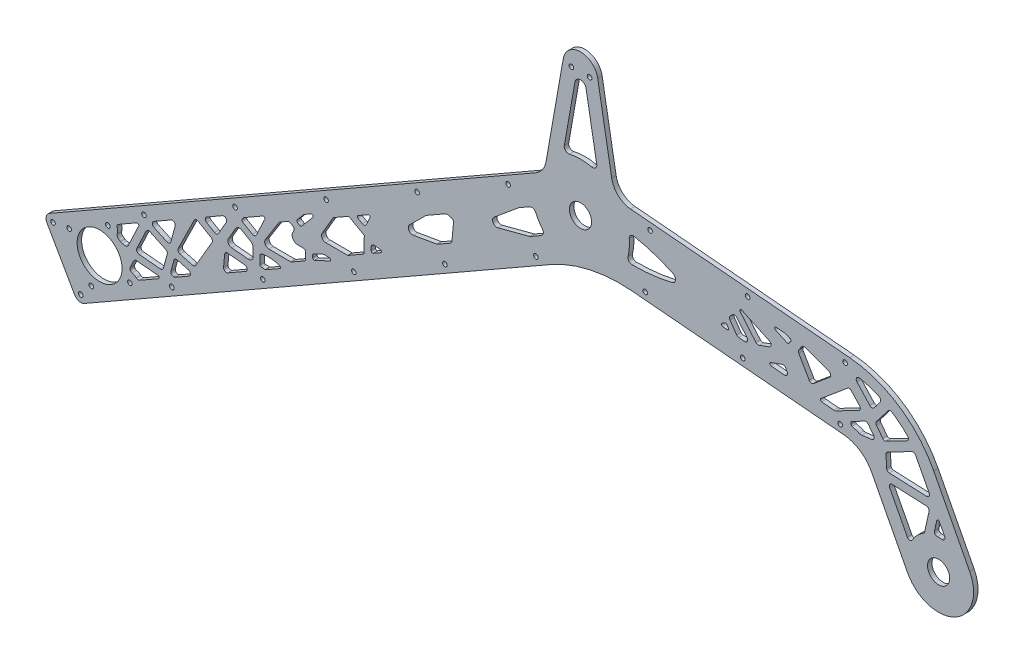
from build123d import *

# Parameters (mm, degrees)
SKETCH2_R              = 7.9375
SKETCH2_R_2            = 16.05
SKETCH2_R_3            = 1.65
BASE_DEPTH             = 3.175
SKETCH3_R              = 1.65
STRUT_HOLES_DEPTH      = 448.434897902
LIGHTENING_HOLES_DEPTH = 448.434897902


with BuildPart() as part:
    # Sketch2 → Base (new body)
    with BuildSketch(Plane.XY):
        with BuildLine():
            Line((-379.716809958, -188.506893436), (-32.006532147, 10.487277971))
            ThreePointArc((-32.006532147, 10.487277971), (-27.186230121, 14.879084252), (-24.685038782, 20.901319377))
            Line((-24.685038782, 20.901319377), (-12.310096913, 91.083102221))
            ThreePointArc((-12.310096913, 91.083102221), (0, 101.4125), (12.310096913, 91.083102221))
            Line((12.310096913, 91.083102221), (22.322003955, 34.302755831))
            ThreePointArc((22.322003955, 34.302755831), (26.960267136, 25.848318444), (35.786784109, 21.964558025))
            Line((35.786784109, 21.964558025), (192.586144941, 8.246391504))
            ThreePointArc((192.586144941, 8.246391504), (227.717231711, -4.10798993), (252.575276723, -31.83706486))
            Line((252.575276723, -31.83706486), (278.255270829, -81.167874559))
            ThreePointArc((278.255270829, -81.167874559), (267.623715331, -114.886860719), (233.904729171, -104.255305221))
            Line((233.904729171, -104.255305221), (208.224735064, -54.924495522))
            ThreePointArc((208.224735064, -54.924495522), (199.93872006, -45.681470545), (188.228357804, -41.563343401))
            Line((188.228357804, -41.563343401), (36.823729736, -28.317154839))
            ThreePointArc((36.823729736, -28.317154839), (6.649577682, -30.266109959), (-21.562664076, -41.144864173))
            Line((-21.562664076, -41.144864173), (-354.881400189, -231.902773674))
            ThreePointArc((-354.881400189, -231.902773674), (-358.677364619, -232.387866435), (-361.70452919, -230.046726627))
            Line((-361.70452919, -230.046726627), (-381.572857005, -195.330022437))
            ThreePointArc((-381.572857005, -195.330022437), (-382.057949767, -191.534058007), (-379.716809958, -188.506893436))
        make_face()
        Circle(SKETCH2_R, mode=Mode.SUBTRACT)
        with Locations((-343.92, -196.825)):
            Circle(SKETCH2_R_2, mode=Mode.SUBTRACT)
        with Locations((-6.5, 88.9125)):
            Circle(SKETCH2_R_3, mode=Mode.SUBTRACT)
        with Locations((6.5, 88.9125)):
            Circle(SKETCH2_R_3, mode=Mode.SUBTRACT)
        with Locations((256.08, -92.71158989)):
            Circle(SKETCH2_R, mode=Mode.SUBTRACT)
        with Locations((-365.631063534, -190.919094461)):
            Circle(SKETCH2_R_3, mode=Mode.SUBTRACT)
        with Locations((-338.014094461, -175.113936466)):
            Circle(SKETCH2_R_3, mode=Mode.SUBTRACT)
        with Locations((-322.208936466, -202.730905539)):
            Circle(SKETCH2_R_3, mode=Mode.SUBTRACT)
        with Locations((-349.825905539, -218.536063534)):
            Circle(SKETCH2_R_3, mode=Mode.SUBTRACT)
    extrude(amount=BASE_DEPTH)

    # Sketch3 → Strut Holes (cut, through all)
    with BuildSketch(Plane.XY.offset(3.175)):
        with Locations((-357.364941166, -227.56318565)):
            Circle(SKETCH3_R)
        with Locations((-292.27112081, -190.310070996)):
            Circle(SKETCH3_R)
        with Locations((-227.177300453, -153.056956343)):
            Circle(SKETCH3_R)
        with Locations((-162.083480097, -115.803841689)):
            Circle(SKETCH3_R)
        with Locations((-96.98965974, -78.550727035)):
            Circle(SKETCH3_R)
        with Locations((-31.895839384, -41.297612382)):
            Circle(SKETCH3_R)
        with Locations((-312.139448625, -155.593366806)):
            Circle(SKETCH3_R)
        with Locations((-377.233268981, -192.84648146)):
            Circle(SKETCH3_R)
        with Locations((-247.045628268, -118.340252152)):
            Circle(SKETCH3_R)
        with Locations((-181.951807912, -81.087137499)):
            Circle(SKETCH3_R)
        with Locations((-116.857987555, -43.834022845)):
            Circle(SKETCH3_R)
        with Locations((-51.764167199, -6.580908192)):
            Circle(SKETCH3_R)
        with Locations((46.269308527, -24.124436716)):
            Circle(SKETCH3_R)
        with Locations((116.002937393, -30.225338708)):
            Circle(SKETCH3_R)
        with Locations((185.73656626, -36.326240701)):
            Circle(SKETCH3_R)
        with Locations((189.222795969, 3.521547223)):
            Circle(SKETCH3_R)
        with Locations((119.489167103, 9.622449215)):
            Circle(SKETCH3_R)
        with Locations((49.755538237, 15.723351208)):
            Circle(SKETCH3_R)
    extrude(amount=-STRUT_HOLES_DEPTH, mode=Mode.SUBTRACT)

    # Sketch6 → Lightening Holes (cut, through all)
    with BuildSketch(Plane.XY.offset(3.175)):
        with BuildLine():
            Line((-315.269185897, -197.710920307), (-301.759255291, -189.979203363))
            ThreePointArc((-301.759255291, -189.979203363), (-301.27885272, -188.89855459), (-302.165025934, -188.115429161))
            Line((-302.165025934, -188.115429161), (-317.529091672, -186.71244549))
            ThreePointArc((-317.529091672, -186.71244549), (-318.704383169, -186.968323474), (-319.520360019, -187.852045956))
            Line((-319.520360019, -187.852045956), (-321.920665487, -192.94890269))
            ThreePointArc((-321.920665487, -192.94890269), (-322.086706026, -193.488507205), (-322.095332893, -194.053014132))
            ThreePointArc((-322.095332893, -194.053014132), (-322.08483495, -194.136958475), (-322.074659882, -194.220942566))
            ThreePointArc((-322.074659882, -194.220942566), (-321.584640098, -195.311697425), (-320.559879114, -195.927920176))
            ThreePointArc((-320.559879114, -195.927920176), (-318.977814459, -196.521247692), (-317.584009883, -197.476378529))
            ThreePointArc((-317.584009883, -197.476378529), (-316.464213346, -197.964897395), (-315.269185897, -197.710920307))
        make_face()
        with BuildLine():
            Line((-289.844978396, -183.160677107), (-279.93882887, -177.491399715))
            ThreePointArc((-279.93882887, -177.491399715), (-278.948378644, -175.502042811), (-280.407275879, -173.825692191))
            Line((-280.407275879, -173.825692191), (-288.292322007, -171.680779414))
            ThreePointArc((-288.292322007, -171.680779414), (-289.810707779, -171.874816518), (-290.747163702, -173.085682346))
            Line((-290.747163702, -173.085682346), (-292.868560549, -180.884280112))
            ThreePointArc((-292.868560549, -180.884280112), (-292.613471256, -182.502456625), (-291.234784363, -183.387209827))
            ThreePointArc((-291.234784363, -183.387209827), (-291.195764259, -183.393163574), (-291.156778347, -183.399337252))
            ThreePointArc((-291.156778347, -183.399337252), (-290.480404568, -183.392541824), (-289.844978396, -183.160677107))
        make_face()
        with BuildLine():
            Line((-225.068253149, -146.0890356), (-215.065938543, -140.36472305))
            ThreePointArc((-215.065938543, -140.36472305), (-214.567033215, -139.40324417), (-215.236329185, -138.55154524))
            ThreePointArc((-215.236329185, -138.55154524), (-221.331874052, -137.268264968), (-227.555460503, -137.531793255))
            ThreePointArc((-227.555460503, -137.531793255), (-228.747493021, -138.209832448), (-229.222550686, -139.49630005))
            Line((-229.222550686, -139.49630005), (-229.243920799, -145.124584195))
            ThreePointArc((-229.243920799, -145.124584195), (-228.903638362, -145.87990104), (-228.110599563, -146.11945299))
            ThreePointArc((-228.110599563, -146.11945299), (-226.935128796, -146.061146676), (-225.766503733, -146.200597789))
            ThreePointArc((-225.766503733, -146.200597789), (-225.407188584, -146.208593442), (-225.068253149, -146.0890356))
        make_face()
        with BuildLine():
            Line((-202.41887229, -105.511400104), (-200.686234771, -106.520529682))
            ThreePointArc((-200.686234771, -106.520529682), (-200.013042452, -106.64186894), (-199.419351845, -106.302100524))
            Line((-199.419351845, -106.302100524), (-191.360868047, -96.772094027))
            ThreePointArc((-191.360868047, -96.772094027), (-191.355986863, -95.486528074), (-192.621174572, -95.258484862))
            Line((-192.621174572, -95.258484862), (-197.478989202, -98.038606299))
            ThreePointArc((-197.478989202, -98.038606299), (-197.765321596, -98.237482482), (-198.01276947, -98.483058387))
            Line((-198.01276947, -98.483058387), (-202.679186023, -104.001587826))
            ThreePointArc((-202.679186023, -104.001587826), (-202.901047671, -104.817187109), (-202.41887229, -105.511400104))
        make_face()
        with BuildLine():
            Line((-330.425499061, -170.667183769), (-317.378257487, -163.200263197))
            ThreePointArc((-317.378257487, -163.200263197), (-316.203164595, -163.333473919), (-315.976852671, -164.494237166))
            Line((-315.976852671, -164.494237166), (-323.402158767, -180.26128093))
            ThreePointArc((-323.402158767, -180.26128093), (-324.218135617, -181.145003412), (-325.393427114, -181.400881396))
            Line((-325.393427114, -181.400881396), (-327.826064744, -181.178742873))
            ThreePointArc((-327.826064744, -181.178742873), (-328.456346912, -181.014705953), (-329.000507167, -180.656860539))
            ThreePointArc((-329.000507167, -180.656860539), (-329.788551481, -179.963737807), (-330.608754561, -179.308986045))
            ThreePointArc((-330.608754561, -179.308986045), (-331.300981929, -178.333954341), (-331.313186478, -177.138246768))
            ThreePointArc((-331.313186478, -177.138246768), (-331.014233087, -175.069882607), (-331.339196402, -173.005445087))
            ThreePointArc((-331.339196402, -173.005445087), (-331.294912573, -171.675100882), (-330.425499061, -170.667183769))
        make_face()
        with BuildLine():
            Line((-295.53330948, -171.631597975), (-298.296173769, -181.788333758))
            ThreePointArc((-298.296173769, -181.788333758), (-299.085121934, -182.906012266), (-300.407921189, -183.255077571))
            Line((-300.407921189, -183.255077571), (-315.662540801, -181.862088072))
            ThreePointArc((-315.662540801, -181.862088072), (-317.216500905, -180.86379127), (-317.290058936, -179.018262152))
            Line((-317.290058936, -179.018262152), (-310.641451377, -164.900475625))
            ThreePointArc((-310.641451377, -164.900475625), (-309.508957679, -163.870619434), (-307.979945409, -163.943195111))
            Line((-307.979945409, -163.943195111), (-296.611069066, -169.297235353))
            ThreePointArc((-296.611069066, -169.297235353), (-295.647370018, -170.26828046), (-295.53330948, -171.631597975))
        make_face()
        with BuildLine():
            Line((-292.778723285, -149.121979529), (-305.215642876, -156.239613568))
            ThreePointArc((-305.215642876, -156.239613568), (-306.220639762, -158.055100377), (-305.074339213, -159.784842018))
            Line((-305.074339213, -159.784842018), (-295.766029178, -164.168482495))
            ThreePointArc((-295.766029178, -164.168482495), (-294.075568316, -164.17490103), (-292.984044137, -162.884058635))
            Line((-292.984044137, -162.884058635), (-289.85543458, -151.38278412))
            ThreePointArc((-289.85543458, -151.38278412), (-290.561768266, -149.275742292), (-292.778723285, -149.121979529))
        make_face()
        with BuildLine():
            Line((-286.412158457, -167.010536912), (-277.477694151, -169.440915421))
            ThreePointArc((-277.477694151, -169.440915421), (-276.194379154, -169.361694864), (-275.224483334, -168.5176123))
            Line((-275.224483334, -168.5176123), (-263.487039881, -148.364863469))
            ThreePointArc((-263.487039881, -148.364863469), (-263.281478176, -146.847994939), (-264.208712124, -145.63005284))
            Line((-264.208712124, -145.63005284), (-273.491108909, -140.223762697))
            ThreePointArc((-273.491108909, -140.223762697), (-275.075155334, -140.037188202), (-276.291924346, -141.06844292))
            Line((-276.291924346, -141.06844292), (-287.68143532, -164.197103385))
            ThreePointArc((-287.68143532, -164.197103385), (-287.710247586, -165.903135064), (-286.412158457, -167.010536912))
        make_face()
        with BuildLine():
            Line((-267.326941544, -134.555955625), (-255.981699002, -128.063087041))
            ThreePointArc((-255.981699002, -128.063087041), (-253.568709634, -128.390088491), (-253.260041176, -130.805491443))
            Line((-253.260041176, -130.805491443), (-258.957478514, -140.587777008))
            ThreePointArc((-258.957478514, -140.587777008), (-260.175420613, -141.515010956), (-261.692289142, -141.309449251))
            Line((-261.692289142, -141.309449251), (-267.340094346, -138.02003227))
            ThreePointArc((-267.340094346, -138.02003227), (-268.333510737, -136.284197061), (-267.326941544, -134.555955625))
        make_face()
        with BuildLine():
            Line((-255.261313261, -159.742391016), (-254.488576255, -151.280152708))
            ThreePointArc((-254.488576255, -151.280152708), (-253.776611846, -149.925068788), (-252.314987955, -149.470314621))
            Line((-252.314987955, -149.470314621), (-240.229659184, -150.573897437))
            ThreePointArc((-240.229659184, -150.573897437), (-238.457312757, -152.140148294), (-239.418117899, -154.30144584))
            Line((-239.418117899, -154.30144584), (-252.276183677, -161.660101332))
            ThreePointArc((-252.276183677, -161.660101332), (-254.350596062, -161.606956723), (-255.261313261, -159.742391016))
        make_face()
        with BuildLine():
            Line((-246.540160509, -131.189393308), (-251.794794147, -140.211401578))
            ThreePointArc((-251.794794147, -140.211401578), (-251.868704934, -143.096387582), (-249.475244653, -144.708825158))
            Line((-249.475244653, -144.708825158), (-237.508018237, -145.801623349))
            ThreePointArc((-237.508018237, -145.801623349), (-235.21684764, -145.033565045), (-234.235227202, -142.825444219))
            Line((-234.235227202, -142.825444219), (-234.211718457, -136.633904573))
            ThreePointArc((-234.211718457, -136.633904573), (-234.607944018, -135.132389326), (-235.701843043, -134.030151758))
            Line((-235.701843043, -134.030151758), (-242.437944567, -130.106884943))
            ThreePointArc((-242.437944567, -130.106884943), (-244.713247361, -129.798542386), (-246.540160509, -131.189393308))
        make_face()
        with BuildLine():
            Line((-241.753564235, -124.719255848), (-234.63976684, -128.862501783))
            ThreePointArc((-234.63976684, -128.862501783), (-233.039032694, -129.043963991), (-231.823804406, -127.986373074))
            Line((-231.823804406, -127.986373074), (-225.796901327, -115.1887263))
            ThreePointArc((-225.796901327, -115.1887263), (-226.023213251, -114.027963054), (-227.198306143, -113.894752332))
            Line((-227.198306143, -113.894752332), (-240.486863137, -121.499777426))
            ThreePointArc((-240.486863137, -121.499777426), (-240.868014227, -121.782834524), (-241.171709307, -122.147754751))
            ThreePointArc((-241.171709307, -122.147754751), (-241.549582312, -122.675396768), (-241.974698217, -123.165774758))
            ThreePointArc((-241.974698217, -123.165774758), (-242.240299662, -123.996061899), (-241.753564235, -124.719255848))
        make_face()
        with BuildLine():
            Line((-215.668807888, -112.174898455), (-225.379976009, -127.585503674))
            ThreePointArc((-225.379976009, -127.585503674), (-225.4712487, -130.629365716), (-222.853276851, -132.184888211))
            Line((-222.853276851, -132.184888211), (-207.454371398, -132.243356535))
            ThreePointArc((-207.454371398, -132.243356535), (-206.936478287, -132.177174092), (-206.453361233, -131.979206161))
            Line((-206.453361233, -131.979206161), (-197.505650544, -126.858442157))
            ThreePointArc((-197.505650544, -126.858442157), (-196.770825499, -126.12917614), (-196.499081351, -125.130200721))
            Line((-196.499081351, -125.130200721), (-196.484480993, -121.28487852))
            ThreePointArc((-196.484480993, -121.28487852), (-197.064893599, -119.868450986), (-198.476872802, -119.277299162))
            Line((-198.476872802, -119.277299162), (-202.260748213, -119.262932112))
            ThreePointArc((-202.260748213, -119.262932112), (-205.751377346, -117.188902119), (-205.629680425, -113.130419396))
            Line((-205.629680425, -113.130419396), (-205.026921593, -112.173904352))
            ThreePointArc((-205.026921593, -112.173904352), (-204.776566908, -110.63116148), (-205.712412279, -109.379392142))
            Line((-205.712412279, -109.379392142), (-207.46181523, -108.360497976))
            ThreePointArc((-207.46181523, -108.360497976), (-208.460790649, -108.088753828), (-209.461800813, -108.352904202))
            Line((-209.461800813, -108.352904202), (-214.9701644, -111.50533402))
            ThreePointArc((-214.9701644, -111.50533402), (-215.360592232, -111.79722492), (-215.668807888, -112.174898455))
        make_face()
        with BuildLine():
            Line((-191.479772218, -120.054212502), (-191.486581073, -121.847472571))
            ThreePointArc((-191.486581073, -121.847472571), (-191.027086278, -122.692614758), (-190.067414214, -122.759175345))
            Line((-190.067414214, -122.759175345), (-179.245533818, -117.762785652))
            ThreePointArc((-179.245533818, -117.762785652), (-178.687597118, -116.642148596), (-179.660910998, -115.854886972))
            Line((-179.660910998, -115.854886972), (-183.284876561, -115.841127086))
            ThreePointArc((-183.284876561, -115.841127086), (-183.717932672, -115.886891136), (-184.13081847, -116.025300894))
            Line((-184.13081847, -116.025300894), (-190.898953493, -119.150103501))
            ThreePointArc((-190.898953493, -119.150103501), (-191.321124727, -119.517511391), (-191.479772218, -120.054212502))
        make_face()
        with BuildLine():
            Line((-166.401123038, -107.905175585), (-182.204856698, -107.845170163))
            ThreePointArc((-182.204856698, -107.845170163), (-184.797218852, -106.335316373), (-184.785828191, -103.335337998))
            Line((-184.785828191, -103.335337998), (-176.831995141, -89.678905885))
            Line((-176.831995141, -89.678905885), (-165.638950905, -83.273140207))
            Line((-165.638950905, -83.273140207), (-154.64049223, -89.678905885))
            Line((-154.64049223, -89.678905885), (-154.684235374, -101.199614947))
            Line((-154.684235374, -101.199614947), (-166.401123038, -107.905175585))
        make_face()
        with BuildLine():
            Line((-149.666734346, -96.599830521), (-149.657550536, -94.181074309))
            ThreePointArc((-149.657550536, -94.181074309), (-149.003136911, -92.708993759), (-147.475689846, -92.196954889))
            Line((-147.475689846, -92.196954889), (-143.284670701, -92.579661624))
            ThreePointArc((-143.284670701, -92.579661624), (-142.398497488, -93.362787052), (-142.878900059, -94.443435825))
            Line((-142.878900059, -94.443435825), (-148.170033359, -97.471545013))
            ThreePointArc((-148.170033359, -97.471545013), (-149.170026151, -97.467748126), (-149.666734346, -96.599830521))
        make_face()
        with BuildLine():
            Line((-159.124748889, -79.545070273), (-152.013980011, -75.475585845))
            ThreePointArc((-152.013980011, -75.475585845), (-150.838887119, -75.608796567), (-150.612575195, -76.769559813))
            Line((-150.612575195, -76.769559813), (-153.182146906, -82.225839878))
            ThreePointArc((-153.182146906, -82.225839878), (-154.397375194, -83.283430795), (-155.99810934, -83.101968586))
            Line((-155.99810934, -83.101968586), (-159.13132529, -81.277108596))
            ThreePointArc((-159.13132529, -81.277108596), (-159.628033486, -80.409190991), (-159.124748889, -79.545070273))
        make_face()
        with BuildLine():
            Line((-90.819864813, -49.698540482), (-91.896421351, -61.487904644))
            ThreePointArc((-91.896421351, -61.487904644), (-92.359955239, -62.836585977), (-93.393866555, -63.818844799))
            Line((-93.393866555, -63.818844799), (-101.994338017, -68.740884214))
            ThreePointArc((-101.994338017, -68.740884214), (-102.469113289, -68.960084777), (-102.974739436, -69.09351133))
            Line((-102.974739436, -69.09351133), (-119.629879497, -71.965101226))
            ThreePointArc((-119.629879497, -71.965101226), (-122.805875604, -70.383853511), (-122.252853304, -66.87936183))
            Line((-122.252853304, -66.87936183), (-110.681116507, -55.395166432))
            ThreePointArc((-110.681116507, -55.395166432), (-110.385100172, -55.137548838), (-110.057990454, -54.920773084))
            Line((-110.057990454, -54.920773084), (-96.724691463, -47.290142199))
            ThreePointArc((-96.724691463, -47.290142199), (-95.614849419, -46.918095089), (-94.447112805, -46.999086542))
            Line((-94.447112805, -46.999086542), (-92.286608626, -47.586793062))
            ThreePointArc((-92.286608626, -47.586793062), (-91.168930118, -48.375741228), (-90.819864813, -49.698540482))
        make_face()
        with BuildLine():
            Line((-28.096781534, -26.449402024), (-35.825401618, -30.87248195))
            ThreePointArc((-35.825401618, -30.87248195), (-36.178007781, -31.044706772), (-36.550077199, -31.169433846))
            Line((-36.550077199, -31.169433846), (-59.133973609, -37.128958431))
            ThreePointArc((-59.133973609, -37.128958431), (-62.565695554, -35.603385935), (-61.819045791, -31.92281518))
            Line((-61.819045791, -31.92281518), (-44.317223042, -17.349924163))
            ThreePointArc((-44.317223042, -17.349924163), (-44.108986088, -17.191390869), (-43.887724451, -17.051609889))
            Line((-43.887724451, -17.051609889), (-36.274597881, -12.694626761))
            ThreePointArc((-36.274597881, -12.694626761), (-33.845543285, -12.449097133), (-32.038330666, -14.090612767))
            ThreePointArc((-32.038330666, -14.090612767), (-29.904900702, -18.185073934), (-27.251097742, -21.963097956))
            ThreePointArc((-27.251097742, -21.963097956), (-26.638826778, -24.401372335), (-28.096781534, -26.449402024))
        make_face()
        with BuildLine():
            Line((-11.599665343, 37.524455033), (-3.986146646, 80.702865203))
            ThreePointArc((-3.986146646, 80.702865203), (0, 84.047639383), (3.986146646, 80.702865203))
            Line((3.986146646, 80.702865203), (11.599665343, 37.524455033))
            ThreePointArc((11.599665343, 37.524455033), (10.707449692, 34.824680589), (7.962722972, 34.082180723))
            ThreePointArc((7.962722972, 34.082180723), (0, 35), (-7.962722972, 34.082180723))
            ThreePointArc((-7.962722972, 34.082180723), (-10.707449692, 34.824680589), (-11.599665343, 37.524455033))
        make_face()
        with BuildLine():
            Line((246.075987756, -72.913561708), (249.254007124, -58.57844272))
            ThreePointArc((249.254007124, -58.57844272), (248.888121791, -56.928040634), (247.388653885, -56.147467049))
            Line((247.388653885, -56.147467049), (222.962162816, -55.080983417))
            ThreePointArc((222.962162816, -55.080983417), (221.188141149, -56.004480644), (221.100902375, -58.002577087))
            Line((221.100902375, -58.002577087), (233.735290203, -82.273010289))
            ThreePointArc((233.735290203, -82.273010289), (235.484637714, -83.349360854), (237.260008731, -82.316498325))
            ThreePointArc((237.260008731, -82.316498325), (240.657318696, -77.731906936), (245.140979083, -74.202461834))
            ThreePointArc((245.140979083, -74.202461834), (245.742284649, -73.655075389), (246.075987756, -72.913561708))
        make_face()
        with BuildLine():
            Line((253.133679234, -68.799730633), (254.751992566, -61.499990928))
            ThreePointArc((254.751992566, -61.499990928), (255.597762381, -60.72498568), (256.615299406, -61.254681929))
            Line((256.615299406, -61.254681929), (260.345615198, -68.420551892))
            ThreePointArc((260.345615198, -68.420551892), (260.223925452, -70.470902803), (258.359543018, -71.332775993))
            ThreePointArc((258.359543018, -71.332775993), (256.767087179, -71.222571503), (255.170843908, -71.230820928))
            ThreePointArc((255.170843908, -71.230820928), (253.553325039, -70.51716267), (253.133679234, -68.799730633))
        make_face()
        with BuildLine():
            Line((249.310771487, -47.22281435), (239.59747458, -28.563744597))
            ThreePointArc((239.59747458, -28.563744597), (238.424864512, -27.579807922), (236.899955687, -27.713220157))
            Line((236.899955687, -27.713220157), (219.565597936, -36.736915644))
            ThreePointArc((219.565597936, -36.736915644), (218.757044355, -37.510937311), (218.490998719, -38.598176086))
            Line((218.490998719, -38.598176086), (218.860832904, -47.068771554))
            ThreePointArc((218.860832904, -47.068771554), (219.444715785, -48.395746342), (220.771690573, -48.979629223))
            Line((220.771690573, -48.979629223), (247.449511046, -50.144408019))
            ThreePointArc((247.449511046, -50.144408019), (249.223532712, -49.220910793), (249.310771487, -47.22281435))
        make_face()
        with BuildLine():
            Line((233.413458883, -22.763883833), (218.618137266, -30.46584077))
            ThreePointArc((218.618137266, -30.46584077), (217.261760811, -30.644411118), (216.107933359, -29.909341962))
            Line((216.107933359, -29.909341962), (211.671799483, -24.128059737))
            ThreePointArc((211.671799483, -24.128059737), (211.258506163, -22.910536879), (211.671799483, -21.693014021))
            Line((211.671799483, -21.693014021), (220.007167815, -10.830150518))
            ThreePointArc((220.007167815, -10.830150518), (221.257760997, -10.076118732), (222.687548657, -10.3731953))
            ThreePointArc((222.687548657, -10.3731953), (228.553817552, -14.676513168), (233.918900039, -19.590528361))
            ThreePointArc((233.918900039, -19.590528361), (234.465065341, -21.304449895), (233.413458883, -22.763883833))
        make_face()
        with BuildLine():
            Line((209.61657846, -31.305721344), (205.746256457, -26.261819508))
            ThreePointArc((205.746256457, -26.261819508), (204.592429004, -25.526750352), (203.23605255, -25.7053207))
            Line((203.23605255, -25.7053207), (194.010059092, -30.508068903))
            ThreePointArc((194.010059092, -30.508068903), (193.616895834, -30.876306478), (193.471807705, -31.395079736))
            Line((193.471807705, -31.395079736), (193.471807705, -32.496691451))
            ThreePointArc((193.471807705, -32.496691451), (193.684204256, -33.112873898), (194.23116932, -33.467306291))
            ThreePointArc((194.23116932, -33.467306291), (196.89746606, -34.245224393), (199.491371204, -35.238175037))
            ThreePointArc((199.491371204, -35.238175037), (200.2654041, -35.454155852), (201.069000396, -35.456918226))
            Line((201.069000396, -35.456918226), (208.290924164, -34.506133925))
            ThreePointArc((208.290924164, -34.506133925), (209.877630844, -33.288611067), (209.61657846, -31.305721344))
        make_face()
        with BuildLine():
            Line((214.303083467, -8.407780179), (209.957683706, -14.070815403))
            ThreePointArc((209.957683706, -14.070815403), (208.4582158, -14.851388988), (206.896422352, -14.20447296))
            Line((206.896422352, -14.20447296), (197.688681904, -4.155987535))
            ThreePointArc((197.688681904, -4.155987535), (197.423723958, -1.817844179), (199.566737265, -0.845933158))
            ThreePointArc((199.566737265, -0.845933158), (206.676023639, -2.722269436), (213.536897173, -5.366320289))
            ThreePointArc((213.536897173, -5.366320289), (214.655785228, -6.701693203), (214.303083467, -8.407780179))
        make_face()
        with BuildLine():
            Line((193.681402215, -11.624307007), (199.545514004, -18.023862053))
            ThreePointArc((199.545514004, -18.023862053), (200.040574836, -19.722338824), (198.994456557, -21.149064135))
            Line((198.994456557, -21.149064135), (182.807531418, -29.575444012))
            ThreePointArc((182.807531418, -29.575444012), (182.007556544, -29.856767353), (181.16081835, -29.902995606))
            Line((181.16081835, -29.902995606), (172.48260155, -29.143750017))
            ThreePointArc((172.48260155, -29.143750017), (171.616040342, -28.448261118), (171.926969683, -27.381510875))
            Line((171.926969683, -27.381510875), (190.921272322, -11.443398536))
            ThreePointArc((190.921272322, -11.443398536), (192.3376538, -10.979769576), (193.681402215, -11.624307007))
        make_face()
        with BuildLine():
            Line((178.199205815, -11.022517891), (166.591800736, -20.762287211))
            ThreePointArc((166.591800736, -20.762287211), (164.958929162, -21.199813831), (163.574174709, -20.230198325))
            Line((163.574174709, -20.230198325), (156.047951006, -7.194396481))
            ThreePointArc((156.047951006, -7.194396481), (155.78190537, -6.107157706), (156.141697725, -5.047243608))
            Line((156.141697725, -5.047243608), (158.18845934, -2.124165087))
            ThreePointArc((158.18845934, -2.124165087), (159.22535183, -1.363884058), (160.510803716, -1.391932718))
            Line((160.510803716, -1.391932718), (177.597670882, -7.611043763))
            ThreePointArc((177.597670882, -7.611043763), (178.883246101, -9.143132649), (178.199205815, -11.022517891))
        make_face()
        with BuildLine():
            Line((146.644806866, -20.907673079), (147.746965574, -22.816667961))
            ThreePointArc((147.746965574, -22.816667961), (147.701697658, -24.891267177), (145.840603281, -25.809057357))
            Line((145.840603281, -25.809057357), (136.229987031, -24.968237386))
            ThreePointArc((136.229987031, -24.968237386), (135.325697913, -24.10256888), (135.975122631, -23.032350067))
            Line((135.975122631, -23.032350067), (144.228715771, -20.028287838))
            ThreePointArc((144.228715771, -20.028287838), (145.596796345, -20.028287838), (146.644806866, -20.907673079))
        make_face()
        with BuildLine():
            Line((134.974345297, -13.819003275), (127.671845659, -16.476895779))
            ThreePointArc((127.671845659, -16.476895779), (126.470167282, -16.52936219), (125.455716486, -15.883085757))
            Line((125.455716486, -15.883085757), (114.198527576, -2.46729043))
            ThreePointArc((114.198527576, -2.46729043), (114.171218678, -1.215741392), (115.387190281, -0.918195034))
            Line((115.387190281, -0.918195034), (135.135541534, -10.127002459))
            ThreePointArc((135.135541534, -10.127002459), (136.288401454, -12.026856808), (134.974345297, -13.819003275))
        make_face()
        with BuildLine():
            Line((139.430597275, -1.096040654), (147.83182135, -5.013595778))
            ThreePointArc((147.83182135, -5.013595778), (148.513258657, -5.073213817), (149.073591656, -4.680864427))
            Line((149.073591656, -4.680864427), (150.425898479, -2.749570135))
            ThreePointArc((150.425898479, -2.749570135), (150.560463385, -1.875287899), (149.948766578, -1.236301077))
            Line((149.948766578, -1.236301077), (146.098496258, 0.165082713))
            ThreePointArc((146.098496258, 0.165082713), (145.72175467, 0.274892872), (145.333903056, 0.334588945))
            Line((145.333903056, 0.334588945), (139.940371279, 0.806461832))
            ThreePointArc((139.940371279, 0.806461832), (138.88728971, 0.069086179), (139.430597275, -1.096040654))
        make_face()
        with BuildLine():
            Line((111.660494937, -7.221200049), (119.04545342, -16.022250853))
            ThreePointArc((119.04545342, -16.022250853), (119.2873862, -18.231323299), (117.339053048, -19.300215468))
            Line((117.339053048, -19.300215468), (113.116226003, -18.930765974))
            ThreePointArc((113.116226003, -18.930765974), (112.290537488, -18.670427385), (111.6522334, -18.08552945))
            Line((111.6522334, -18.08552945), (106.877510971, -11.266519132))
            ThreePointArc((106.877510971, -11.266519132), (106.523425664, -9.945054773), (107.101601497, -8.705152697))
            Line((107.101601497, -8.705152697), (108.714192488, -7.092561706))
            ThreePointArc((108.714192488, -7.092561706), (110.215644825, -6.508678825), (111.660494937, -7.221200049))
        make_face()
        with BuildLine():
            Line((104.703890017, -15.136053881), (105.75536165, -16.637710998))
            ThreePointArc((105.75536165, -16.637710998), (105.80223501, -17.711287434), (104.849053863, -18.207482132))
            Line((104.849053863, -18.207482132), (101.67727128, -17.929987113))
            ThreePointArc((101.67727128, -17.929987113), (100.788131016, -17.150232029), (101.264427023, -16.067767011))
            Line((101.264427023, -16.067767011), (103.384737973, -14.843604914))
            ThreePointArc((103.384737973, -14.843604914), (104.101177587, -14.73333431), (104.703890017, -15.136053881))
        make_face()
        with BuildLine():
            ThreePointArc((34.863622447, 3.086718303), (34.900341082, -2.63935454), (34.002891304, -8.294780463))
            ThreePointArc((34.002891304, -8.294780463), (34.552114447, -10.851108963), (36.89804352, -12.005699039))
            ThreePointArc((36.89804352, -12.005699039), (51.290024205, -11.233136631), (65.485577957, -8.740705208))
            ThreePointArc((65.485577957, -8.740705208), (67.910545504, -5.973310403), (66.09771963, -2.77134164))
            ThreePointArc((66.09771963, -2.77134164), (52.541526947, 2.603547383), (38.433463256, 6.29439159))
            ThreePointArc((38.433463256, 6.29439159), (35.846829531, 5.582787002), (34.863622447, 3.086718303))
        make_face()
    extrude(amount=-LIGHTENING_HOLES_DEPTH, mode=Mode.SUBTRACT)


solid = part.part
